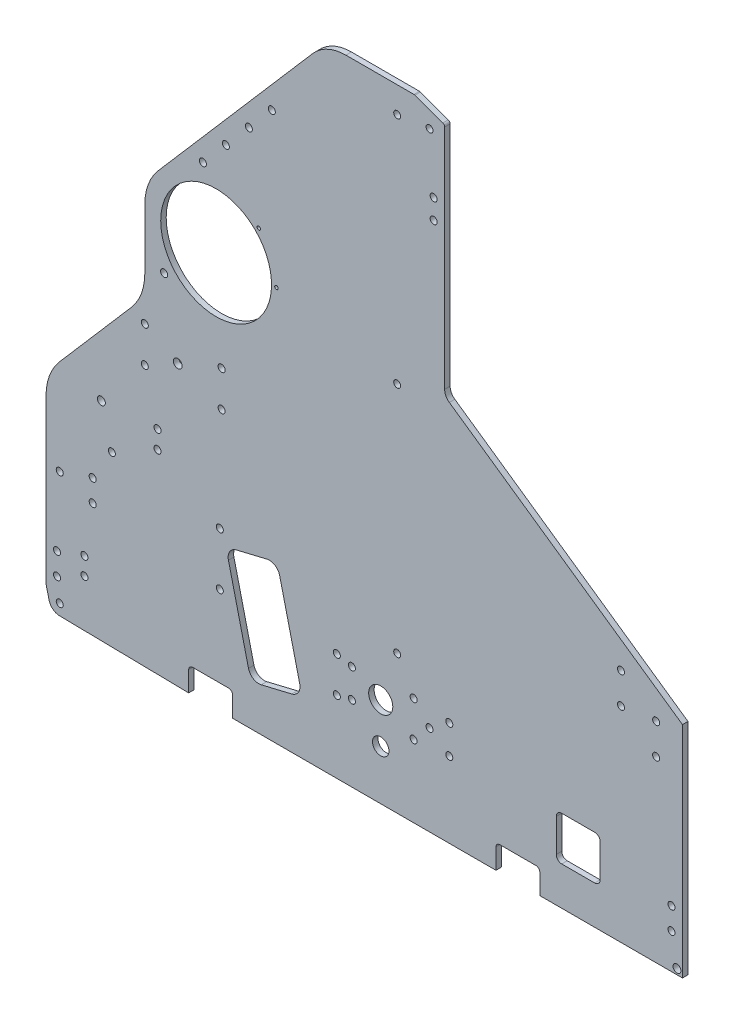
from build123d import *

# Parameters (mm, degrees)
SKETCH1_R           = 2.032
SKETCH1_R_2         = 2.54
SKETCH1_R_3         = 2
BOSS_EXTRUDE1_DEPTH = 3.175
FILLET1_R           = 2.286
FILLET2_R           = 6.35
SKETCH2_R           = 2.032
CUT_EXTRUDE1_DEPTH  = 505.524983177
FILLET3_R           = 1.5875
SKETCH3_R           = 2.032
SKETCH3_R_2         = 2.286
SKETCH3_R_3         = 1.016
CUT_EXTRUDE2_DEPTH  = 505.524983177
SKETCH4_R           = 2.032
SKETCH4_R_2         = 6.985
SKETCH4_R_3         = 4.7625
CUT_EXTRUDE3_DEPTH  = 505.524983177
SKETCH5_R           = 32.0675
SKETCH5_R_2         = 2.286
CUT_EXTRUDE5_DEPTH  = 540.282512258
FILLET4_R           = 31.75
CUT_EXTRUDE6_DEPTH  = 505.524983177
SKETCH7_R           = 2.032
CUT_EXTRUDE7_DEPTH  = 2.54
FILLET5_R           = 25.4


with BuildPart() as part:
    # Sketch1 → Boss-Extrude1 (new body)
    with BuildSketch(Plane.XY):
        with BuildLine():
            Line((7.829508682, -19.049081656), (82.55, -20.32))
            Line((82.55, -20.32), (82.55, -6.35))
            Line((82.55, -6.35), (107.95, -6.35))
            Line((107.95, -6.35), (107.95, -20.32))
            Line((107.95, -20.32), (260.35, -20.32))
            Line((260.35, -20.32), (260.35, -6.35))
            Line((260.35, -6.35), (285.75, -6.35))
            Line((285.75, -6.35), (285.75, -20.32))
            Line((285.75, -20.32), (368.3, -20.32))
            Line((368.3, -20.32), (368.3, 106.68))
            Line((368.3, 106.68), (230.66375, 202.565))
            Line((230.66375, 202.565), (230.66375, 338.455))
            Line((230.66375, 338.455), (213.19998, 344.805))
            Line((213.19998, 344.805), (203.2, 344.805))
            Line((203.2, 344.805), (161.925, 344.805))
            Line((161.925, 344.805), (52.720122664, 218.469945827))
            ThreePointArc((52.720122664, 218.469945827), (52.803835479, 218.142145922), (52.832, 217.805))
            ThreePointArc((52.832, 217.805), (52.095493096, 216.239521914), (50.419872403, 215.808871996))
            Line((50.419872403, 215.808871996), (0, 157.48))
            Line((0, 157.48), (0, 0))
            Line((0, 0), (0, -6.35))
            ThreePointArc((0, -6.35), (0.047577015, -7.125863724), (0.189595124, -7.890101219))
            Line((0.189595124, -7.890101219), (1.777095124, -14.240101219))
            ThreePointArc((1.777095124, -14.240101219), (3.987212552, -17.671692778), (7.829508682, -19.049081656))
        make_face()
        with Locations((7.9375, -12.7)):
            Circle(SKETCH1_R, mode=Mode.SUBTRACT)
        with Locations((6.35, 0)):
            Circle(SKETCH1_R, mode=Mode.SUBTRACT)
        with Locations((6.35, 12.7)):
            Circle(SKETCH1_R, mode=Mode.SUBTRACT)
        with Locations((38.1, 78.105)):
            Circle(SKETCH1_R, mode=Mode.SUBTRACT)
        with Locations((57.15, 131.28625)):
            Circle(SKETCH1_R, mode=Mode.SUBTRACT)
        with Locations((57.15, 151.92375)):
            Circle(SKETCH1_R, mode=Mode.SUBTRACT)
        with Locations((76.2, 141.605)):
            Circle(SKETCH1_R_2, mode=Mode.SUBTRACT)
        with Locations((101.6, 131.28625)):
            Circle(SKETCH1_R, mode=Mode.SUBTRACT)
        with Locations((101.6, 151.92375)):
            Circle(SKETCH1_R, mode=Mode.SUBTRACT)
        with Locations((203.2, 59.805)):
            Circle(SKETCH1_R_3, mode=Mode.SUBTRACT)
        with Locations((361.95, 0)):
            Circle(SKETCH1_R, mode=Mode.SUBTRACT)
        with Locations((361.95, 12.7)):
            Circle(SKETCH1_R, mode=Mode.SUBTRACT)
        with Locations((353.06, 82.955052336)):
            Circle(SKETCH1_R, mode=Mode.SUBTRACT)
        with Locations((332.74, 98.195052336)):
            Circle(SKETCH1_R, mode=Mode.SUBTRACT)
        with Locations((332.74, 115.975052336)):
            Circle(SKETCH1_R, mode=Mode.SUBTRACT)
        with Locations((353.06, 100.735052336)):
            Circle(SKETCH1_R, mode=Mode.SUBTRACT)
        with Locations((68.326, 182.923674932)):
            Circle(SKETCH1_R, mode=Mode.SUBTRACT)
        with Locations((76.2, 217.805)):
            Circle(SKETCH1_R, mode=Mode.SUBTRACT)
        with Locations((90.779500502, 249.682)):
            Circle(SKETCH1_R, mode=Mode.SUBTRACT)
        with Locations((104.067838673, 265.054783374)):
            Circle(SKETCH1_R, mode=Mode.SUBTRACT)
        with Locations((117.356176844, 280.427566748)):
            Circle(SKETCH1_R, mode=Mode.SUBTRACT)
        with Locations((130.644515014, 295.800350122)):
            Circle(SKETCH1_R, mode=Mode.SUBTRACT)
        with Locations((203.2, 194.805)):
            Circle(SKETCH1_R_3, mode=Mode.SUBTRACT)
        with Locations((224.31375, 287.401)):
            Circle(SKETCH1_R, mode=Mode.SUBTRACT)
        with Locations((224.31375, 298.831)):
            Circle(SKETCH1_R, mode=Mode.SUBTRACT)
        with Locations((203.2, 329.805)):
            Circle(SKETCH1_R_3, mode=Mode.SUBTRACT)
        with Locations((221.931865, 332.105)):
            Circle(SKETCH1_R_3, mode=Mode.SUBTRACT)
    extrude(amount=BOSS_EXTRUDE1_DEPTH)

    # Fillet1
    fillet1_edges = [part.edges().sort_by_distance(p)[0] for p in [
        (285.75, -6.35, 1.5875),
        (107.95, -6.35, 1.5875),
        (260.35, -6.35, 1.5875),
        (82.55, -6.35, 1.5875),
    ]]
    fillet(fillet1_edges, radius=FILLET1_R)

    # Fillet2
    fillet2_edges = [part.edges().sort_by_distance(p)[0] for p in [
        (230.66375, 202.565, 1.5875),
    ]]
    fillet(fillet2_edges, radius=FILLET2_R)

    # Sketch2 → Cut-Extrude1 (cut, through all)
    with BuildSketch(Plane(origin=(0, 0, 0), x_dir=(-1, 0, 0), z_dir=(0, 0, -1))):
        with Locations((-100.552770272, 71.086035298)):
            Circle(SKETCH2_R)
        with Locations((-100.552770272, 40.606035298)):
            Circle(SKETCH2_R)
        with Locations((-22.225, 18.202541089)):
            Circle(SKETCH2_R)
        with Locations((-22.225, 8.042541089)):
            Circle(SKETCH2_R)
    extrude(amount=-CUT_EXTRUDE1_DEPTH, mode=Mode.SUBTRACT)

    # Fillet3
    fillet3_edges = [part.edges().sort_by_distance(p)[0] for p in [
        (230.66375, 338.455, 1.5875),
        (213.19998, 344.805, 1.5875),
    ]]
    fillet(fillet3_edges, radius=FILLET3_R)

    # Sketch3 → Cut-Extrude2 (cut, through all)
    with BuildSketch(Plane.XY.offset(3.175)):
        with BuildLine():
            Line((127.789350211, 69.359774106), (110.090750339, 65.117184968))
            ThreePointArc((110.090750339, 65.117184968), (106.287939855, 62.356288953), (105.55119507, 57.715047577))
            Line((105.55119507, 57.715047577), (117.160037875, 9.287010566))
            ThreePointArc((117.160037875, 9.287010566), (119.92093389, 5.484200083), (124.562175265, 4.747455297))
            Line((124.562175265, 4.747455297), (142.260775137, 8.990044434))
            ThreePointArc((142.260775137, 8.990044434), (146.063585621, 11.75094045), (146.800330407, 16.392181825))
            Line((146.800330407, 16.392181825), (135.191487602, 64.820218836))
            ThreePointArc((135.191487602, 64.820218836), (132.430591586, 68.62302932), (127.789350211, 69.359774106))
        make_face()
        with Locations((26.987500002, 46.953113935)):
            Circle(SKETCH3_R)
        with Locations((26.987500002, 59.653113935)):
            Circle(SKETCH3_R)
        with Locations((7.937500002, 53.303113935)):
            Circle(SKETCH3_R)
        with Locations((32.030600738, 100.810868776)):
            Circle(SKETCH3_R_2)
        with Locations((64.525942114, 102.94048958)):
            Circle(SKETCH3_R)
        with Locations((64.525942114, 92.525786339)):
            Circle(SKETCH3_R)
        with Locations((133.35, 208.228121768)):
            Circle(SKETCH3_R_3)
        with Locations((123.120704333, 232.923826101)):
            Circle(SKETCH3_R_3)
    extrude(amount=-CUT_EXTRUDE2_DEPTH, mode=Mode.SUBTRACT)

    # Sketch4 → Cut-Extrude3 (cut, through all)
    with BuildSketch(Plane.XY.offset(3.175)):
        with Locations((168.275, 42.06875)):
            Circle(SKETCH4_R)
        with Locations((212.725, 42.06875)):
            Circle(SKETCH4_R)
        with Locations((212.725, 21.43125)):
            Circle(SKETCH4_R)
        with Locations((168.275, 21.43125)):
            Circle(SKETCH4_R)
        with Locations((193.675, 31.75)):
            Circle(SKETCH4_R_2)
        with Locations((177.00498, 40.0431)):
            Circle(SKETCH4_R)
        with Locations((177.00498, 23.4569)):
            Circle(SKETCH4_R)
        with Locations((193.675, 8.466666658)):
            Circle(SKETCH4_R_3)
        with Locations((221.931865, 31.75)):
            Circle(SKETCH4_R)
        with Locations((233.36123, 23.4569)):
            Circle(SKETCH4_R)
        with Locations((233.36123, 40.0431)):
            Circle(SKETCH4_R)
    extrude(amount=-CUT_EXTRUDE3_DEPTH, mode=Mode.SUBTRACT)

    # Sketch5 → Cut-Extrude5 (cut, through all)
    with BuildSketch(Plane(origin=(0, 0, -187.325000005), x_dir=(-1, 0, 0), z_dir=(0, 0, -1))):
        Polygon((0, 157.48), (-57.15, 223.594705882), (-57.15, 165.333696112), (0, 99.218990229), align=None)
        with Locations((-98.425, 208.228121768)):
            Circle(SKETCH5_R)
        with Locations((-365.124993902, -17.144956474)):
            Circle(SKETCH5_R_2)
    extrude(amount=-CUT_EXTRUDE5_DEPTH, mode=Mode.SUBTRACT)

    # Fillet4
    fillet4_edges = [part.edges().sort_by_distance(p)[0] for p in [
        (0, 99.218990229, 1.5875),
        (57.15, 165.333696112, 1.5875),
        (57.15, 223.594705882, 1.5875),
    ]]
    fillet(fillet4_edges, radius=FILLET4_R)

    # Sketch6 → Cut-Extrude6 (cut, through all)
    with BuildSketch(Plane.XY.offset(3.175)):
        with BuildLine():
            Line((298.45, 27.305), (317.5, 27.305))
            ThreePointArc((317.5, 27.305), (319.74506403, 26.37506403), (320.675, 24.13))
            Line((320.675, 24.13), (320.675, 5.08))
            ThreePointArc((320.675, 5.08), (319.74506403, 2.83493597), (317.5, 1.905))
            Line((317.5, 1.905), (298.45, 1.905))
            ThreePointArc((298.45, 1.905), (296.20493597, 2.83493597), (295.275, 5.08))
            Line((295.275, 5.08), (295.275, 24.13))
            ThreePointArc((295.275, 24.13), (296.20493597, 26.37506403), (298.45, 27.305))
        make_face()
    extrude(amount=-CUT_EXTRUDE6_DEPTH, mode=Mode.SUBTRACT)

    # Sketch7 → Cut-Extrude7 (cut)
    with BuildSketch(Plane(origin=(0, 0, 0), x_dir=(-1, 0, 0), z_dir=(0, 0, -1))):
        with Locations((-215.9, 306.705)):
            Circle(SKETCH7_R)
        with Locations((-203.2, 306.705)):
            Circle(SKETCH7_R)
        with Locations((-190.5, 306.705)):
            Circle(SKETCH7_R)
        with Locations((-177.8, 306.705)):
            Circle(SKETCH7_R)
        with Locations((-215.9, 255.905)):
            Circle(SKETCH7_R)
        with Locations((-203.2, 255.905)):
            Circle(SKETCH7_R)
        with Locations((-190.5, 255.905)):
            Circle(SKETCH7_R)
        with Locations((-177.8, 255.905)):
            Circle(SKETCH7_R)
    extrude(amount=-CUT_EXTRUDE7_DEPTH, mode=Mode.SUBTRACT)

    # Fillet5
    fillet5_edges = [part.edges().sort_by_distance(p)[0] for p in [
        (161.925, 344.805, 1.5875),
    ]]
    fillet(fillet5_edges, radius=FILLET5_R)


solid = part.part
